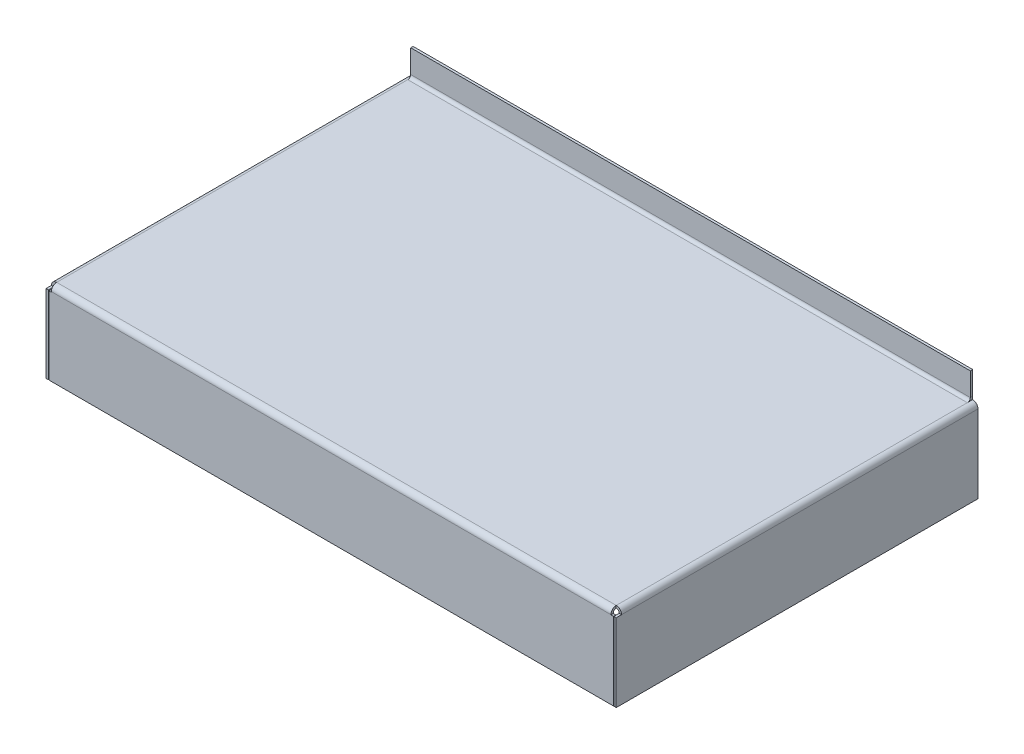
from build123d import *

# Parameters (mm, degrees)
EXTRUDE1_DEPTH               = 150
SHEET_METAL_1_DEPTH          = 150
SHEET_METAL_1_2_DEPTH        = 150
EDGE_FLANGE1_STRIP_W         = 6.5
EDGE_FLANGE1_STRIP_H         = 1
EDGE_FLANGE1_STRIP_CUT_DEPTH = 235.5
EDGE_FLANGE1_DEPTH           = 235.5
SKETCH16_W                   = 1
SKETCH16_H                   = 32.75
EXTRUDE2_DEPTH               = 2.25
EDGE_FLANGE2_DEPTH           = 235.5
EDGE_FLANGE2_START           = 1
EDGE_FLANGE2_FLAT_DEPTH      = 1


# Read off the part's stored shape, not the designer's step: Преобразовать-Твердое тело1
# Sheet-metal steps are written as plain solids
with BuildPart() as part:
    # Sketch1 → Extrude1 (new body)
    with BuildSketch(Plane.XY):
        Polygon((-120, 0), (-120, 35), (120, 35), (120, 0), (119, 0), (119, 34), (-119, 34), (-119, 0), align=None)
    extrude(amount=EXTRUDE1_DEPTH)

    # Sheet Metal 1 outline → Sheet Metal 1 (cut)
    with BuildSketch(Plane.XY):
        with BuildLine():
            Line((120, 35), (117.75, 35))
            ThreePointArc((117.75, 35), (119.340990258, 34.340990258), (120, 32.75))
            Line((120, 32.75), (120, 35))
        make_face()
        with BuildLine():
            ThreePointArc((-120, 32.75), (-119.340990258, 34.340990258), (-117.75, 35))
            Line((-117.75, 35), (-120, 35))
            Line((-120, 35), (-120, 32.75))
        make_face()
    extrude(amount=SHEET_METAL_1_DEPTH, mode=Mode.SUBTRACT)

    # Sheet Metal 1 2 outline → Sheet Metal 1 2 (add)
    with BuildSketch(Plane.XY):
        with BuildLine():
            Line((119, 34), (117.75, 34))
            ThreePointArc((117.75, 34), (118.633883476, 33.633883476), (119, 32.75))
            Line((119, 32.75), (119, 34))
        make_face()
        with BuildLine():
            ThreePointArc((-119, 32.75), (-118.633883476, 33.633883476), (-117.75, 34))
            Line((-117.75, 34), (-119, 34))
            Line((-119, 34), (-119, 32.75))
        make_face()
    extrude(amount=SHEET_METAL_1_2_DEPTH)

    # Edge-Flange1 strip (across the edge) → Edge-Flange1 strip cut (cut)
    with BuildSketch(Plane(origin=(117.75, 35, 0), x_dir=(0, 0, 1), z_dir=(-1, 0, 0))):
        with Locations((-1, -0.5)):
            Rectangle(EDGE_FLANGE1_STRIP_W, EDGE_FLANGE1_STRIP_H)
    extrude(amount=EDGE_FLANGE1_STRIP_CUT_DEPTH, mode=Mode.SUBTRACT)

    # Edge-Flange1 section (across the edge) → Edge-Flange1 (add)
    with BuildSketch(Plane(origin=(117.75, 35, 0), x_dir=(0, 0, 1), z_dir=(-1, 0, 0))):
        with BuildLine():
            Line((0, 1.25), (0, 11))
            Line((0, 11), (1, 11))
            Line((1, 11), (1, 1.25))
            ThreePointArc((1, 1.25), (1.366116524, 0.366116524), (2.25, 0))
            Line((2.25, 0), (2.25, -1))
            ThreePointArc((2.25, -1), (0.659009742, -0.340990258), (0, 1.25))
        make_face()
    extrude(amount=EDGE_FLANGE1_DEPTH)

    # Sketch16 → Extrude2 (add)
    with BuildSketch(Plane.XY.offset(150)):
        with Locations((-119.5, 16.375)):
            Rectangle(SKETCH16_W, SKETCH16_H)
        with Locations((119.5, 16.375)):
            Rectangle(SKETCH16_W, SKETCH16_H)
    extrude(amount=EXTRUDE2_DEPTH)

    # Edge-Flange2 bend section (across the edge) → Edge-Flange2 (add)
    with BuildSketch(Plane(origin=(117.75, 34, 151.25), x_dir=(0, 0, -1), z_dir=(-1, 0, 0))):
        with BuildLine():
            Line((-1, 1.25), (0, 1.25))
            ThreePointArc((0, 1.25), (0.366116524, 0.366116524), (1.25, 0))
            Line((1.25, 0), (1.25, -1))
            ThreePointArc((1.25, -1), (-0.340990258, -0.340990258), (-1, 1.25))
        make_face()
    extrude(amount=EDGE_FLANGE2_DEPTH)

    # Edge-Flange2 profile (on flange) → Edge-Flange2 flat (add)
    with BuildSketch(Plane(origin=(0, 34, 151.25), x_dir=(-1, 0, 0), z_dir=(0, 0, 1)).offset(EDGE_FLANGE2_START)):
        Polygon((-117.75, 1.35), (-117.75, 1.25), (117.75, 1.25), (117.75, 1.5), (118.8, 1.5), (118.8, 34), (-118.8, 34), (-118.8, 1.35), align=None)
    extrude(amount=-EDGE_FLANGE2_FLAT_DEPTH)


solid = part.part
